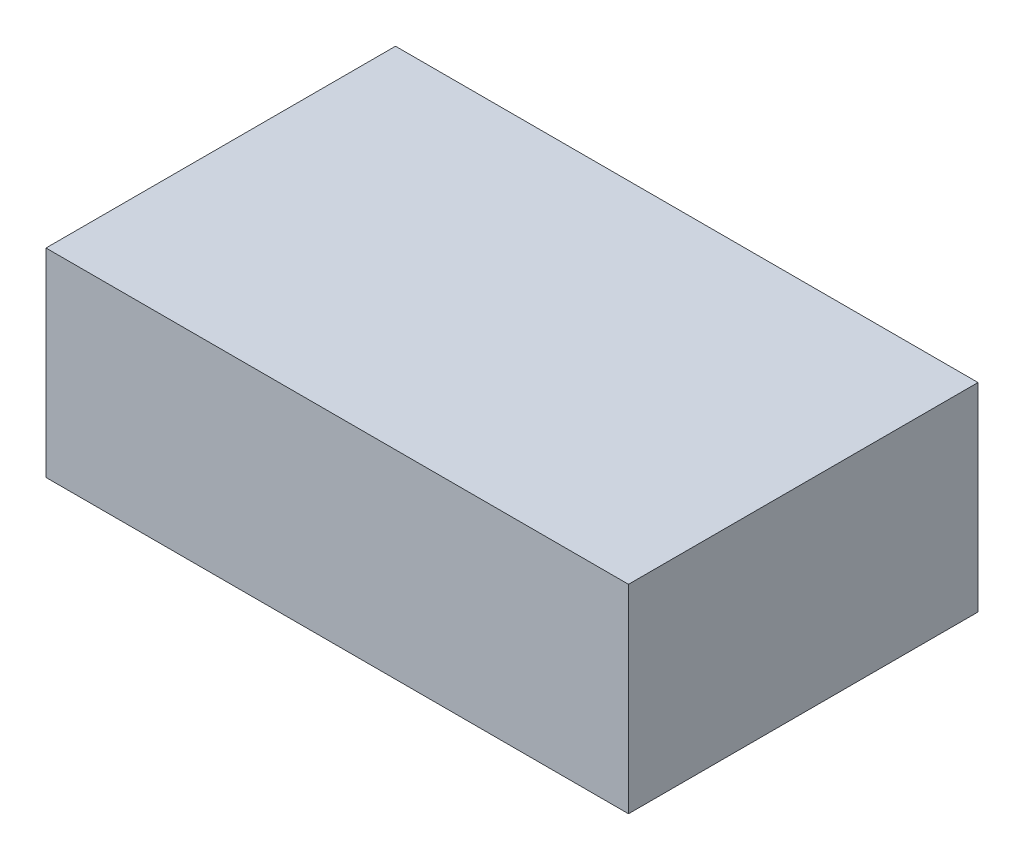
from build123d import *

# Parameters (mm, degrees)
SKETCH1_W           = 38.1
SKETCH1_H           = 22.86
BOSS_EXTRUDE1_DEPTH = 13


with BuildPart() as part:
    # Sketch1 → Boss-Extrude1 (new body)
    with BuildSketch(Plane(origin=(0, 0, 0), x_dir=(1, 0, 0), z_dir=(0, 1, 0))):
        with Locations((19.05, 11.43)):
            Rectangle(SKETCH1_W, SKETCH1_H)
    extrude(amount=BOSS_EXTRUDE1_DEPTH)


solid = part.part
